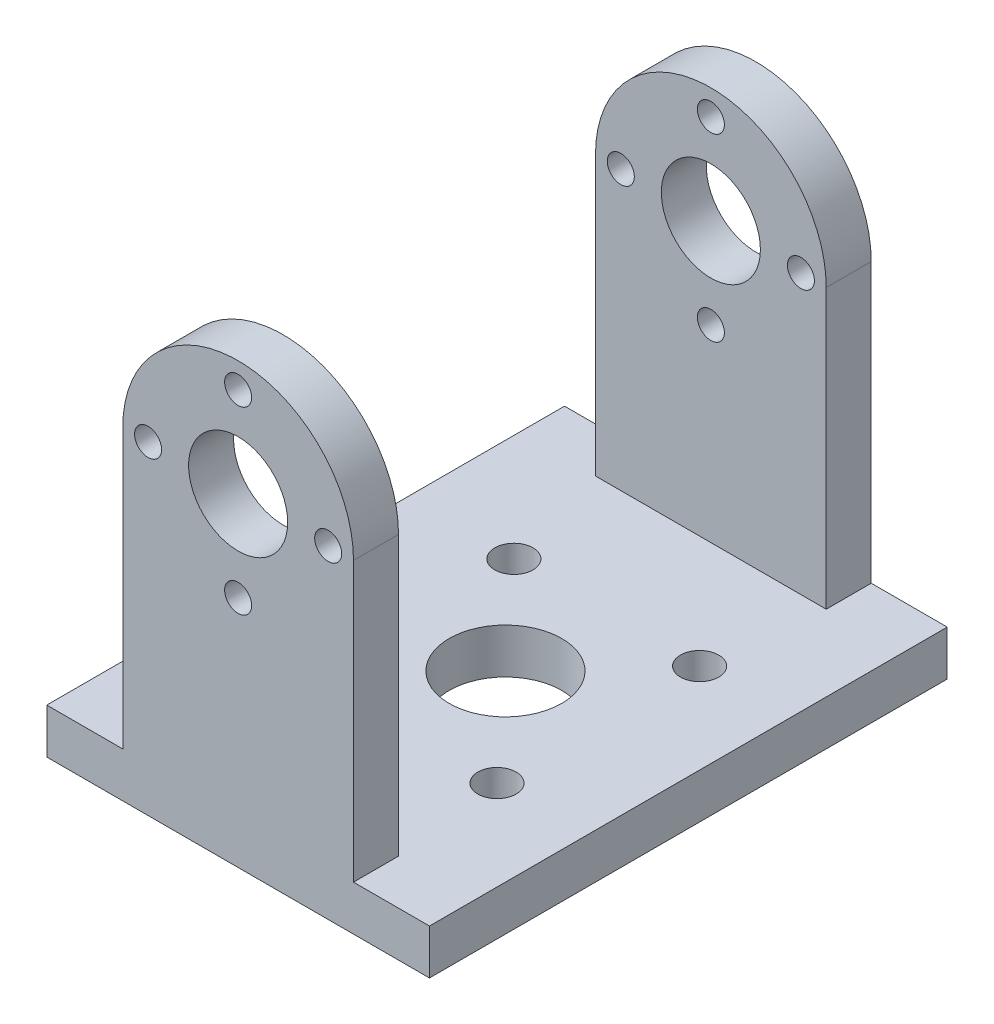
from build123d import *

# Parameters (mm, degrees)
SKETCH1_R           = 1.2
SKETCH1_R_2         = 4.4
BOSS_EXTRUDE1_DEPTH = 4
SKETCH3_W           = 34
SKETCH3_H           = 46
SKETCH3_R           = 5
SKETCH3_R_2         = 1.7
BOSS_EXTRUDE3_DEPTH = 4


with BuildPart() as part:
    # Sketch1 → Boss-Extrude1 (new body)
    with BuildSketch(Plane.XY):
        with BuildLine():
            Line((-10.25, -28.75), (10.25, -28.75))
            Line((10.25, -28.75), (10.25, 0))
            ThreePointArc((10.25, 0), (0, 10.25), (-10.25, 0))
            Line((-10.25, 0), (-10.25, -28.75))
        make_face()
        with Locations((0, 8)):
            Circle(SKETCH1_R, mode=Mode.SUBTRACT)
        with Locations((-8, 0)):
            Circle(SKETCH1_R, mode=Mode.SUBTRACT)
        with Locations((0, -8)):
            Circle(SKETCH1_R, mode=Mode.SUBTRACT)
        with Locations((8, 0)):
            Circle(SKETCH1_R, mode=Mode.SUBTRACT)
        Circle(SKETCH1_R_2, mode=Mode.SUBTRACT)
    boss_extrude1 = extrude(amount=BOSS_EXTRUDE1_DEPTH)

    # Sketch3 → Boss-Extrude3 (add)
    with BuildSketch(Plane(origin=(0, -28.75, 0), x_dir=(-1, 0, 0), z_dir=(0, -1, 0))):
        with Locations((0, -23)):
            Rectangle(SKETCH3_W, SKETCH3_H)
        with Locations((-0.75, -23)):
            Circle(SKETCH3_R, mode=Mode.SUBTRACT)
        with Locations((-9, -14)):
            Circle(SKETCH3_R_2, mode=Mode.SUBTRACT)
        with Locations((7.5, -14)):
            Circle(SKETCH3_R_2, mode=Mode.SUBTRACT)
        with Locations((7.5, -32)):
            Circle(SKETCH3_R_2, mode=Mode.SUBTRACT)
        with Locations((-9, -32)):
            Circle(SKETCH3_R_2, mode=Mode.SUBTRACT)
    extrude(amount=-BOSS_EXTRUDE3_DEPTH)

    # Mirror1: Boss-Extrude1 across plane
    add(boss_extrude1.mirror(Plane.XY.offset(23)))


solid = part.part
